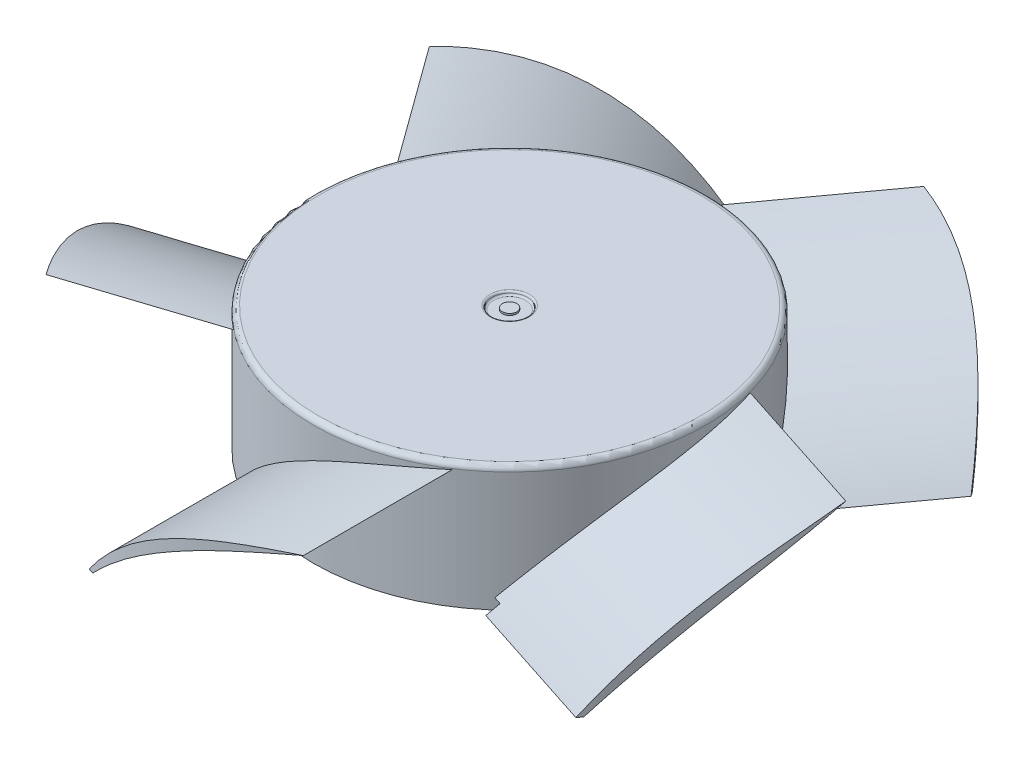
from build123d import *

# Parameters (mm, degrees)
SKETCH1_R                = 11
BOSS_EXTRUDE1_DEPTH      = 7
BOSS_EXTRUDE2_REACH      = 19.059
BOSS_EXTRUDE2_END_RADIUS = 18.55
CIRPATTERN1_COUNT        = 5
SKETCH4_R                = 10
SKETCH4_R_2              = 1.75
SKETCH4_R_3              = 0.75
CUT_EXTRUDE1_DEPTH       = 5.5
FILLET1_R                = 0.3
SKETCH5_R                = 1
CUT_EXTRUDE2_DEPTH       = 0.2
FILLET2_R                = 0.1
SKETCH6_R                = 11.4
SKETCH6_R_2              = 11
CUT_EXTRUDE3_DEPTH       = 0.6
SKETCH7_R                = 0.4
BOSS_EXTRUDE3_DEPTH      = 0.1


with BuildPart() as part:
    # Sketch1 → Boss-Extrude1 (new body)
    with BuildSketch(Plane(origin=(0, 0, 0), x_dir=(1, 0, 0), z_dir=(0, 1, 0))):
        with Locations(Location((0, 0, 0), (0, 0, 270))):
            Circle(SKETCH1_R)
    extrude(amount=BOSS_EXTRUDE1_DEPTH)

    # Boss-Extrude2: up to this cylinder (the profile starts inside it)
    boss_extrude2_end = Plane(origin=(0, 3.843243, 0), z_dir=(0, -1, 0)) * Cylinder(BOSS_EXTRUDE2_END_RADIUS, 76.218, mode=Mode.PRIVATE)
    # Sketch2 → Boss-Extrude2 (add, up to the surface)
    with BuildSketch(Plane.XY, mode=Mode.PRIVATE) as boss_extrude2_sk1:
        with BuildLine():
            Line((-6, 0), (-5.7, 0))
            add(Edge.make_bspline(
                [(6, 6.65), (-0.86634689, 4.993225635), (-5.7, 0)],
                knots=[0, 0, 0, 1, 1, 1], degree=2))
            add(Edge.make_bspline(
                [(6, 6.65), (-1.357374642, 5.918314261), (-6, 0)],
                knots=[0, 0, 0, 1, 1, 1], degree=2))
        make_face()
    boss_extrude2_tool1 = extrude(boss_extrude2_sk1.sketch, amount=BOSS_EXTRUDE2_REACH, mode=Mode.PRIVATE) & boss_extrude2_end
    boss_extrude2 = boss_extrude2_tool1.solids().sort_by_distance((-0.900536, 3.843243, 0))[0]
    add(boss_extrude2)

    # CirPattern1: Boss-Extrude2 ×5 about axis
    cirpattern1_axis = Axis((0, 7, 0), (0, -1, 0))
    for i in range(1, CIRPATTERN1_COUNT):
        add(boss_extrude2.rotate(cirpattern1_axis, i * 360 / CIRPATTERN1_COUNT))

    # Sketch4 → Cut-Extrude1 (cut)
    # profile 1 of 2: a face of its own
    with BuildSketch(Plane.XZ):
        with Locations(Location((0, 0, 0), (0, 0, 270))):
            Circle(SKETCH4_R)
        with Locations(Location((0, 0, 0), (0, 0, 270))):
            Circle(SKETCH4_R_2, mode=Mode.SUBTRACT)
    # profile 2 of 2: a face of its own
    with BuildSketch(Plane.XZ):
        with Locations(Location((0, 0, 0), (0, 0, 270))):
            Circle(SKETCH4_R_3)
    extrude(amount=-CUT_EXTRUDE1_DEPTH, mode=Mode.SUBTRACT)

    # Fillet1
    fillet1_edges = [part.edges().sort_by_distance(p)[0] for p in [
        (0, 7, -11),
    ]]
    fillet(fillet1_edges, radius=FILLET1_R)

    # Sketch5 → Cut-Extrude2 (cut)
    with BuildSketch(Plane(origin=(0, 7, 0), x_dir=(1, 0, 0), z_dir=(0, 1, 0))):
        with Locations(Location((0, 0, 0), (0, 0, 270))):
            Circle(SKETCH5_R)
    extrude(amount=-CUT_EXTRUDE2_DEPTH, mode=Mode.SUBTRACT)

    # Fillet2
    fillet2_edges = [part.edges().sort_by_distance(p)[0] for p in [
        (0, 6.8, -1),
        (0, 7, -1),
    ]]
    fillet(fillet2_edges, radius=FILLET2_R - 0.0001)  # a hair under: the kernel refuses the full size

    # Sketch6 → Cut-Extrude3 (cut)
    with BuildSketch(Plane.XZ):
        Circle(SKETCH6_R)
        with Locations(Location((0, 0, 0), (0, 0, 90))):
            Circle(SKETCH6_R_2, mode=Mode.SUBTRACT)
    extrude(amount=-CUT_EXTRUDE3_DEPTH, mode=Mode.SUBTRACT)

    # Sketch7 → Boss-Extrude3 (add)
    with BuildSketch(Plane(origin=(0, 6.8, 0), x_dir=(1, 0, 0), z_dir=(0, 1, 0))):
        with Locations(Location((0, 0, 0), (0, 0, 270))):
            Circle(SKETCH7_R)
    extrude(amount=BOSS_EXTRUDE3_DEPTH)


solid = part.part
